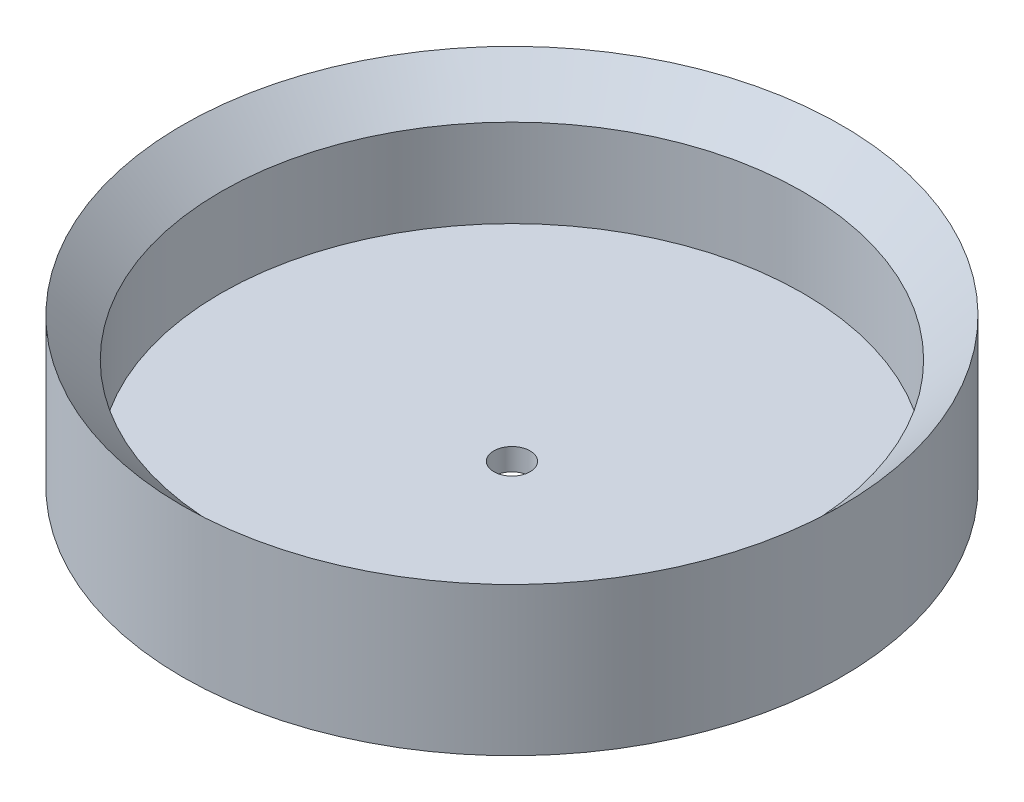
from build123d import *

# Parameters (mm, degrees)
SKETCH_1_R          = 30
SKETCH_1_R_2        = 26.5
EXTRUDE_1_DEPTH     = 15
SKETCH_2_R          = 30
EXTRUDE_2_DEPTH     = 2
CHAMFER_1_SIZE      = 5
SKETCH_3_R          = 1.65
CUT_EXTRUDE_1_DEPTH = 44.957365708


with BuildPart() as part:
    # 草图1 → 凸台-拉伸1 (new body)
    with BuildSketch(Plane(origin=(0, 0, 0), x_dir=(1, 0, 0), z_dir=(0, 1, 0))):
        with Locations(Location((0, 0, 0), (0, 0, 270))):
            Circle(SKETCH_1_R)
        with Locations(Location((0, 0, 0), (0, 0, 270))):
            Circle(SKETCH_1_R_2, mode=Mode.SUBTRACT)
    extrude(amount=EXTRUDE_1_DEPTH)

    # 草图2 → 凸台-拉伸2 (add)
    with BuildSketch(Plane.XZ):
        with Locations(Location((0, 0, 0), (0, 0, 90))):
            Circle(SKETCH_2_R)
    extrude(amount=-EXTRUDE_2_DEPTH)

    # 倒角1
    # the kernel refuses this chamfer: 5 mm, written as the material it takes off along each edge
    with BuildSketch(Plane(origin=(0, 15, 0), x_dir=(0, 0, 1), z_dir=(-1, 0, 0))) as chamfer_1_piece_1:
        Polygon((26.5 + CHAMFER_1_SIZE, 0), (26.5, -CHAMFER_1_SIZE), (26.5, 0), align=None)
    revolve(axis=Axis((0, 15, 0), (0, 1, 0)), mode=Mode.SUBTRACT)

    # 草图3 → 切除-拉伸1 (cut, through all)
    with BuildSketch(Plane(origin=(0, 2, 0), x_dir=(1, 0, 0), z_dir=(0, 1, 0))):
        with Locations(Location((0, 0, 0), (0, 0, 270))):
            Circle(SKETCH_3_R)
    extrude(amount=-CUT_EXTRUDE_1_DEPTH, mode=Mode.SUBTRACT)


solid = part.part
